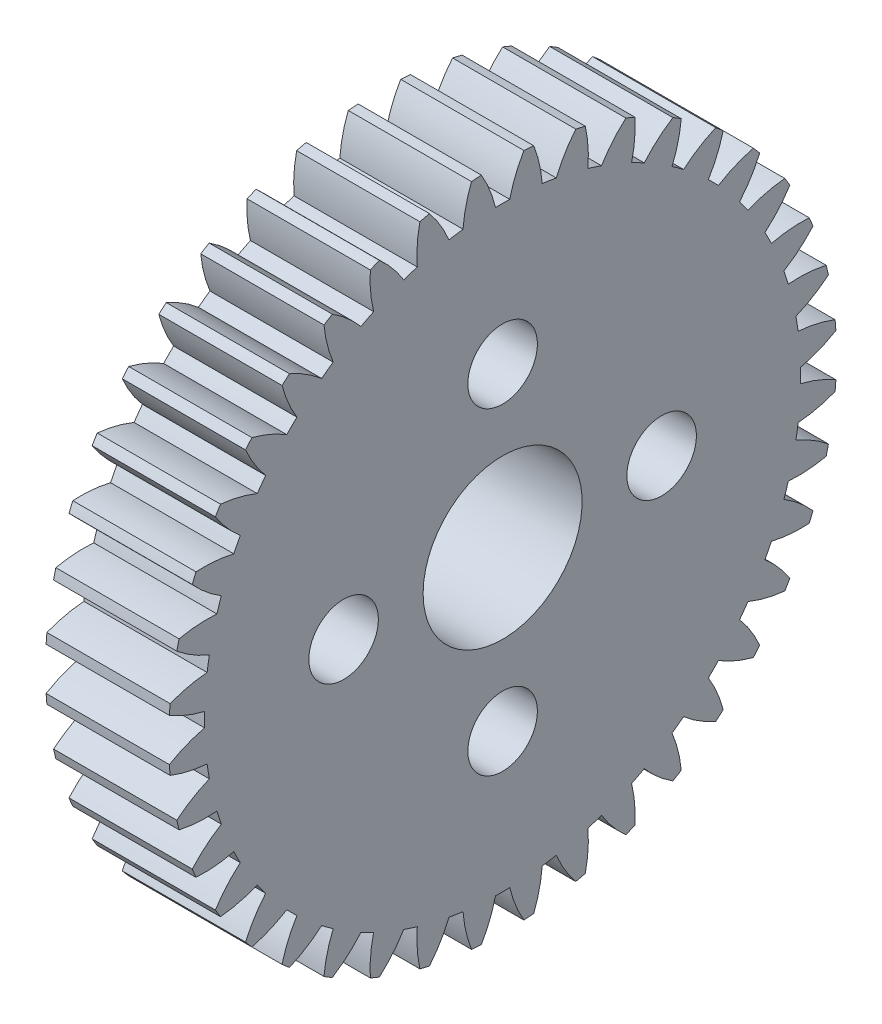
from build123d import *

# Parameters (mm, degrees)
BASPROSKE_W        = 6.2
BASPROSKE_H        = 16.8
TOOTHCUT_DEPTH     = 25.554429336
TEETHCUTS_COUNT    = 40
BORSKE_R           = 4
BORE_DEPTH         = 50.0000508
SKETCH1_R          = 1.75
CUT_EXTRUDE1_DEPTH = 25.50763099


with BuildPart() as part:
    # BasProSke → Base-Revolve (revolve)
    with BuildSketch(Plane(origin=(0, 0, 0), x_dir=(1, 0, 0), z_dir=(0, 1, 0))):
        with Locations((3.1, 8.4)):
            Rectangle(BASPROSKE_W, BASPROSKE_H)
    revolve(axis=Axis((-10, 0, 0), (1, 0, 0)))

    # TooCutSke → ToothCut (cut, through all)
    with BuildSketch(Plane(origin=(0, 0, 0), x_dir=(0, 0, -1), z_dir=(1, 0, 0))):
        with BuildLine():
            ThreePointArc((0.358234928, 14.994721362), (0, 14.999), (-0.358234928, 14.994721362))
            ThreePointArc((-0.358234928, 14.994721362), (-0.653764873, 15.920217236), (-1.085976921, 16.790316831))
            ThreePointArc((-1.085976921, 16.790316831), (0, 16.8254), (1.085976921, 16.790316831))
            ThreePointArc((1.085976921, 16.790316831), (0.653764873, 15.920217236), (0.358234928, 14.994721362))
        make_face()
    toothcut = extrude(amount=TOOTHCUT_DEPTH, mode=Mode.SUBTRACT)

    # TeethCuts: ToothCut ×40 about axis
    teethcuts_axis = Axis((-10, 0, 0), (1, 0, 0))
    for i in range(1, TEETHCUTS_COUNT):
        add(toothcut.rotate(teethcuts_axis, i * 360 / TEETHCUTS_COUNT), mode=Mode.SUBTRACT)

    # BorSke → Bore (cut, symmetric)
    with BuildSketch(Plane(origin=(0, 0, 0), x_dir=(0, 0, -1), z_dir=(1, 0, 0))):
        Circle(BORSKE_R)
    extrude(amount=BORE_DEPTH, both=True, mode=Mode.SUBTRACT)

    # Sketch1 → Cut-Extrude1 (cut, through all)
    with BuildSketch(Plane(origin=(6.2, 0, 0), x_dir=(0, 0, -1), z_dir=(1, 0, 0))):
        with Locations((0, 8)):
            Circle(SKETCH1_R)
        with Locations((0, -8)):
            Circle(SKETCH1_R)
        with Locations((8, 0)):
            Circle(SKETCH1_R)
        with Locations((-8, 0)):
            Circle(SKETCH1_R)
    extrude(amount=-CUT_EXTRUDE1_DEPTH, mode=Mode.SUBTRACT)


solid = part.part
